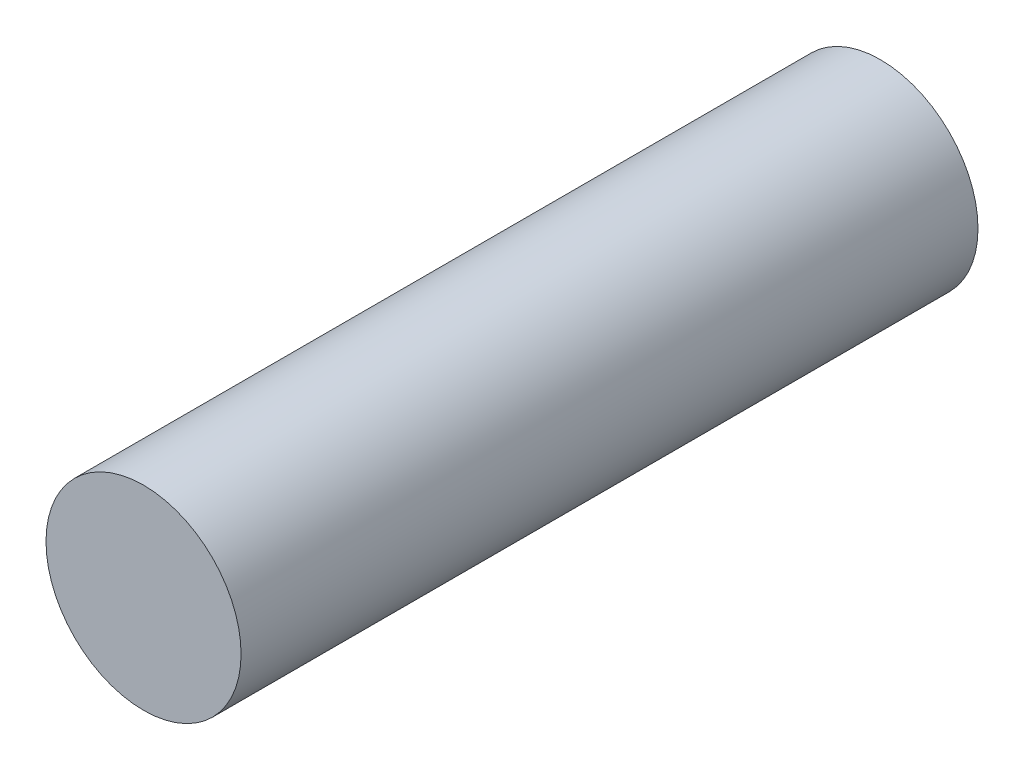
from build123d import *

# Parameters (mm, degrees)
SKETCH1_R           = 2.25
BOSS_EXTRUDE1_DEPTH = 8.5


with BuildPart() as part:
    # Sketch1 → Boss-Extrude1 (new, symmetric)
    with BuildSketch(Plane.XY):
        Circle(SKETCH1_R)
    extrude(amount=BOSS_EXTRUDE1_DEPTH, both=True)


solid = part.part
